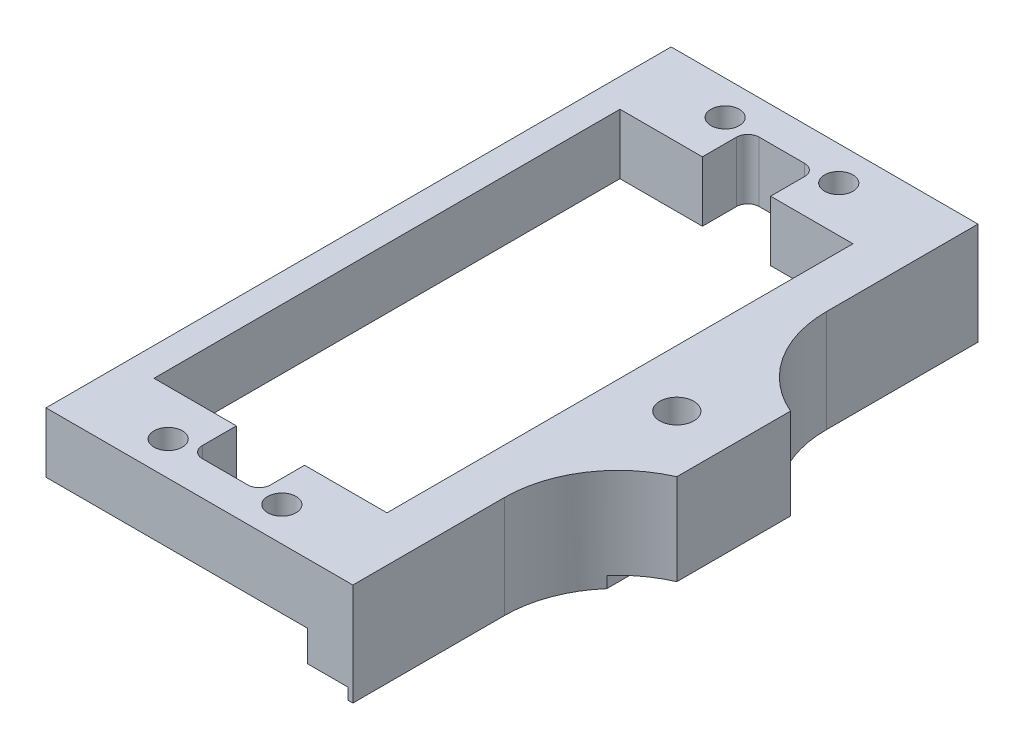
from build123d import *

# Parameters (mm, degrees)
MAIN_DEPTH            = 27.5
SERVOSQUAREHOLE_DEPTH = 37.962819157
SKETCH2_R             = 1.5
SKETCH2_R_2           = 1.25
FIXINGHOLE_DEPTH      = 37.962819157
FILLET1_R             = 1
SKETCH4_W             = 6
SKETCH4_H             = 22.5
CUT_EXTRUDE2_DEPTH    = 37.962819157
FILLET2_R             = 10


with BuildPart() as part:
    # Sketch1 → Main (new, symmetric)
    with BuildSketch(Plane.XY):
        Polygon((10, 0), (10, 8), (-23, 8), (-23, 2.706273437), (0, 2.706273437), (0, 0), (3.55, 0), (3.55, -1), (6.45, -1), (6.45, 0), align=None)
    extrude(amount=MAIN_DEPTH, both=True)

    # Sketch3 → ServoSquareHole (cut, through all)
    with BuildSketch(Plane(origin=(0, 8, 0), x_dir=(1, 0, 0), z_dir=(0, 1, 0))):
        Polygon((-20.5, 20.5), (-13.25, 20.5), (-13.25, 24.5), (-7.25, 24.5), (-7.25, 20.5), (0, 20.5), (0, -20.5), (-7.25, -20.5), (-7.25, -24.5), (-13.25, -24.5), (-13.25, -20.5), (-20.5, -20.5), align=None)
    extrude(amount=-SERVOSQUAREHOLE_DEPTH, mode=Mode.SUBTRACT)

    # Sketch2 → FixingHole (cut, through all)
    with BuildSketch(Plane(origin=(0, 8, 0), x_dir=(1, 0, 0), z_dir=(0, 1, 0))):
        with Locations(Location((5, 0, 0), (0, 0, 180))):
            Circle(SKETCH2_R)
        with Locations(Location((-15.25, 24.5, 0), (0, 0, 180))):
            Circle(SKETCH2_R_2)
        with Locations(Location((-15.25, -24.5, 0), (0, 0, 180))):
            Circle(SKETCH2_R_2)
        with Locations(Location((-5.25, 24.5, 0), (0, 0, 180))):
            Circle(SKETCH2_R_2)
        with Locations(Location((-5.25, -24.5, 0), (0, 0, 180))):
            Circle(SKETCH2_R_2)
    extrude(amount=-FIXINGHOLE_DEPTH, mode=Mode.SUBTRACT)

    # Fillet1
    fillet1_edges = [part.edges().sort_by_distance(p)[0] for p in [
        (-13.25, 5.353136719, -24.5),
        (-7.25, 5.353136719, -24.5),
        (-7.25, 5.353136719, 24.5),
        (-13.25, 5.353136719, 24.5),
    ]]
    fillet(fillet1_edges, radius=FILLET1_R)

    # Sketch4 → Cut-Extrude2 (cut, through all)
    with BuildSketch(Plane(origin=(0, 8, 0), x_dir=(1, 0, 0), z_dir=(0, 1, 0))):
        with Locations((7, 16.25)):
            Rectangle(SKETCH4_W, SKETCH4_H)
        with Locations((7, -16.25)):
            Rectangle(SKETCH4_W, SKETCH4_H)
    extrude(amount=-CUT_EXTRUDE2_DEPTH, mode=Mode.SUBTRACT)

    # Fillet2
    # the kernel refuses this fillet: 10 mm, written as the material it adds along each edge
    with BuildSketch(Plane(origin=(4, 8, 5), x_dir=(1, 0, 0), z_dir=(0, -1, 0))) as fillet2_piece_1_section:
        with BuildLine():
            CenterArc((10, 9.16515139), FILLET2_R, 180, 66.421821522)
            Line((0, 9.16515139), (-0.2, 9.16515139))
            Line((-0.2, 9.16515139), (-0.2, 0))
            Line((-0.2, 0), (0, -0.2))
            ThreePointArc((0, -0.2), (3, -0.2), (5.92, -0.183303028))
            Line((5.92, -0.183303028), (6, 0))
        make_face()
    fillet2_piece_1 = extrude(amount=9, mode=Mode.PRIVATE)
    fillet2_piece_1 = split(fillet2_piece_1, bisect_by=Plane(origin=(7.630084013, 0, 5.669805071), z_dir=(0, 1, 0)), keep=Keep.TOP, mode=Mode.PRIVATE)
    fillet2_piece_1 = split(fillet2_piece_1, bisect_by=Plane(origin=(6.45, 4, 5.669805071), z_dir=(1, 0, 0)), keep=Keep.TOP, mode=Mode.PRIVATE)
    add(fillet2_piece_1)
    with BuildSketch(Plane(origin=(4, 8, 5), x_dir=(1, 0, 0), z_dir=(0, -1, 0))) as fillet2_piece_2_section:
        with BuildLine():
            CenterArc((10, 9.16515139), FILLET2_R, 180, 66.421821522)
            Line((0, 9.16515139), (-0.2, 9.16515139))
            Line((-0.2, 9.16515139), (-0.2, 0))
            Line((-0.2, 0), (0, -0.2))
            ThreePointArc((0, -0.2), (3, -0.2), (5.92, -0.183303028))
            Line((5.92, -0.183303028), (6, 0))
        make_face()
    fillet2_piece_2 = extrude(amount=9, mode=Mode.PRIVATE)
    fillet2_piece_2 = split(fillet2_piece_2, bisect_by=Plane(origin=(4.860609572, 0, 7.751217471), z_dir=(0, 1, 0)), keep=Keep.TOP, mode=Mode.PRIVATE)
    fillet2_piece_2 = split(fillet2_piece_2, bisect_by=Plane(origin=(6.45, 4, 7.751217471), z_dir=(-1, 0, 0)), keep=Keep.TOP, mode=Mode.PRIVATE)
    add(fillet2_piece_2)
    with BuildSketch(Plane(origin=(4, 8, 5), x_dir=(1, 0, 0), z_dir=(0, -1, 0))) as fillet2_piece_3_section:
        with BuildLine():
            CenterArc((10, 9.16515139), FILLET2_R, 180, 66.421821522)
            Line((0, 9.16515139), (-0.2, 9.16515139))
            Line((-0.2, 9.16515139), (-0.2, 0))
            Line((-0.2, 0), (0, -0.2))
            ThreePointArc((0, -0.2), (3, -0.2), (5.92, -0.183303028))
            Line((5.92, -0.183303028), (6, 0))
        make_face()
    fillet2_piece_3 = extrude(amount=9, mode=Mode.PRIVATE)
    fillet2_piece_3 = split(fillet2_piece_3, bisect_by=Plane(origin=(4.860609572, 0, 7.751217471), z_dir=(0, -1, 0)), keep=Keep.TOP, mode=Mode.PRIVATE)
    fillet2_piece_3 = split(fillet2_piece_3, bisect_by=Plane(origin=(6.45, -0.5, 7.751217471), z_dir=(-1, 0, 0)), keep=Keep.TOP, mode=Mode.PRIVATE)
    add(fillet2_piece_3)
    with BuildSketch(Plane(origin=(4, 8, -5), x_dir=(0, 0, -1), z_dir=(0, -1, 0))) as fillet2_piece_4_section:
        with BuildLine():
            CenterArc((9.16515139, 10), FILLET2_R, 203.578178478, 66.421821522)
            Line((0, 6), (-0.183303028, 5.92))
            ThreePointArc((-0.183303028, 5.92), (-0.2, 3), (-0.2, 0))
            Line((-0.2, 0), (0, -0.2))
            Line((0, -0.2), (9.16515139, -0.2))
            Line((9.16515139, -0.2), (9.16515139, 0))
        make_face()
    fillet2_piece_4 = extrude(amount=9, mode=Mode.PRIVATE)
    fillet2_piece_4 = split(fillet2_piece_4, bisect_by=Plane(origin=(6.45, 4, -7.751217471), z_dir=(-1, 0, 0)), keep=Keep.TOP, mode=Mode.PRIVATE)
    fillet2_piece_4 = split(fillet2_piece_4, bisect_by=Plane(origin=(4.860609572, 0, -7.751217471), z_dir=(0, 1, 0)), keep=Keep.TOP, mode=Mode.PRIVATE)
    add(fillet2_piece_4)
    with BuildSketch(Plane(origin=(4, 8, -5), x_dir=(0, 0, -1), z_dir=(0, -1, 0))) as fillet2_piece_5_section:
        with BuildLine():
            CenterArc((9.16515139, 10), FILLET2_R, 203.578178478, 66.421821522)
            Line((0, 6), (-0.183303028, 5.92))
            ThreePointArc((-0.183303028, 5.92), (-0.2, 3), (-0.2, 0))
            Line((-0.2, 0), (0, -0.2))
            Line((0, -0.2), (9.16515139, -0.2))
            Line((9.16515139, -0.2), (9.16515139, 0))
        make_face()
    fillet2_piece_5 = extrude(amount=9, mode=Mode.PRIVATE)
    fillet2_piece_5 = split(fillet2_piece_5, bisect_by=Plane(origin=(6.45, 4, -5.669805071), z_dir=(1, 0, 0)), keep=Keep.TOP, mode=Mode.PRIVATE)
    fillet2_piece_5 = split(fillet2_piece_5, bisect_by=Plane(origin=(7.630084013, 0, -5.669805071), z_dir=(0, 1, 0)), keep=Keep.TOP, mode=Mode.PRIVATE)
    add(fillet2_piece_5)
    with BuildSketch(Plane(origin=(4, 8, -5), x_dir=(0, 0, -1), z_dir=(0, -1, 0))) as fillet2_piece_6_section:
        with BuildLine():
            CenterArc((9.16515139, 10), FILLET2_R, 203.578178478, 66.421821522)
            Line((0, 6), (-0.183303028, 5.92))
            ThreePointArc((-0.183303028, 5.92), (-0.2, 3), (-0.2, 0))
            Line((-0.2, 0), (0, -0.2))
            Line((0, -0.2), (9.16515139, -0.2))
            Line((9.16515139, -0.2), (9.16515139, 0))
        make_face()
    fillet2_piece_6 = extrude(amount=9, mode=Mode.PRIVATE)
    fillet2_piece_6 = split(fillet2_piece_6, bisect_by=Plane(origin=(6.45, -0.5, -7.751217471), z_dir=(-1, 0, 0)), keep=Keep.TOP, mode=Mode.PRIVATE)
    fillet2_piece_6 = split(fillet2_piece_6, bisect_by=Plane(origin=(4.860609572, 0, -7.751217471), z_dir=(0, -1, 0)), keep=Keep.TOP, mode=Mode.PRIVATE)
    add(fillet2_piece_6)


solid = part.part
